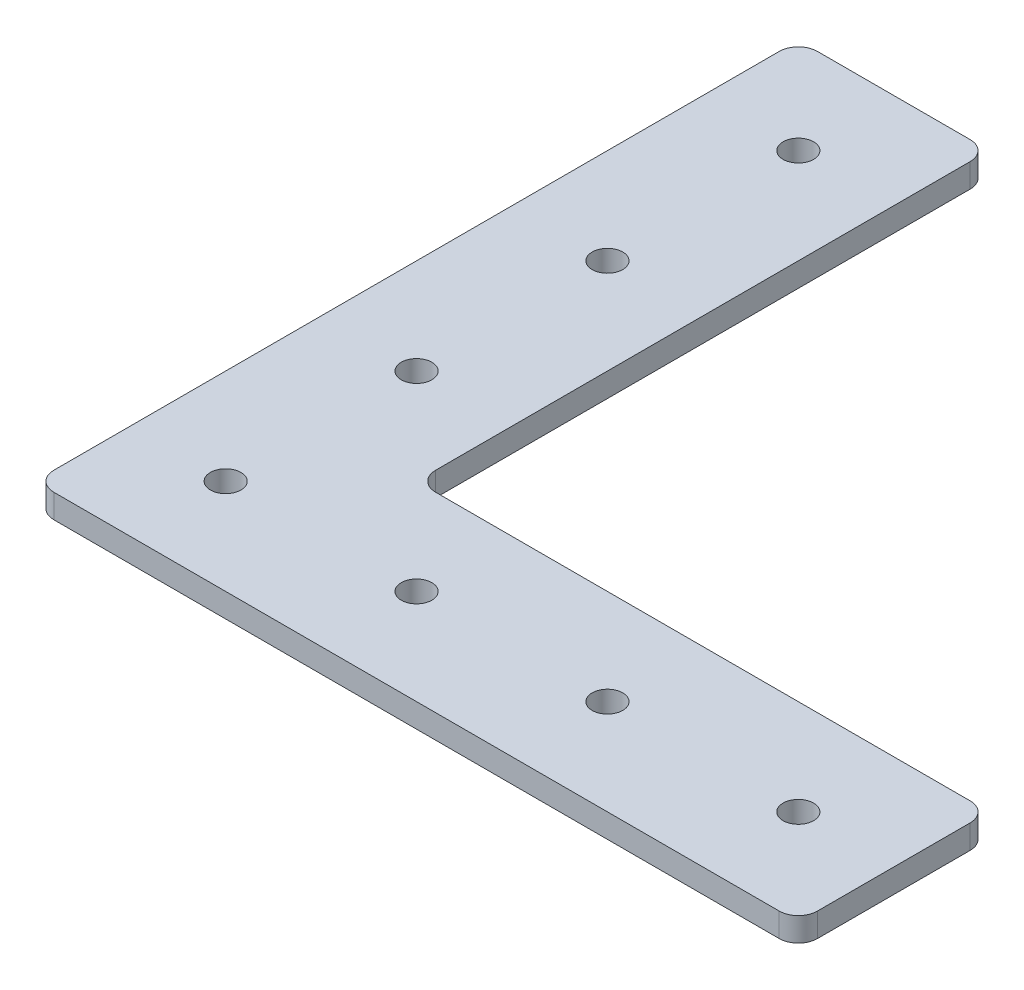
from build123d import *

# Parameters (mm, degrees)
SKETCH1_R           = 2.032
BOSS_EXTRUDE1_DEPTH = 3.175


with BuildPart() as part:
    # Sketch1 → Boss-Extrude1 (new body)
    with BuildSketch(Plane(origin=(0, 0, 0), x_dir=(1, 0, 0), z_dir=(0, 1, 0))):
        with BuildLine():
            ThreePointArc((0, 2.54), (0.743948776, 0.743948776), (2.54, 0))
            Line((2.54, 0), (25.4, 0))
            Line((25.4, 0), (99.06, 0))
            ThreePointArc((99.06, 0), (100.856051224, 0.743948776), (101.6, 2.54))
            Line((101.6, 2.54), (101.6, 22.86))
            ThreePointArc((101.6, 22.86), (100.856051224, 24.656051224), (99.06, 25.4))
            Line((99.06, 25.4), (27.94, 25.4))
            ThreePointArc((27.94, 25.4), (26.143948776, 26.143948776), (25.4, 27.94))
            Line((25.4, 27.94), (25.4, 99.06))
            ThreePointArc((25.4, 99.06), (24.656051224, 100.856051224), (22.86, 101.6))
            Line((22.86, 101.6), (2.54, 101.6))
            ThreePointArc((2.54, 101.6), (0.743948776, 100.856051224), (0, 99.06))
            Line((0, 99.06), (0, 25.4))
            Line((0, 25.4), (0, 2.54))
        make_face()
        with Locations((12.7, 12.7)):
            Circle(SKETCH1_R, mode=Mode.SUBTRACT)
        with Locations((38.1, 12.7)):
            Circle(SKETCH1_R, mode=Mode.SUBTRACT)
        with Locations((12.7, 38.1)):
            Circle(SKETCH1_R, mode=Mode.SUBTRACT)
        with Locations((63.5, 12.7)):
            Circle(SKETCH1_R, mode=Mode.SUBTRACT)
        with Locations((88.9, 12.7)):
            Circle(SKETCH1_R, mode=Mode.SUBTRACT)
        with Locations((12.7, 63.5)):
            Circle(SKETCH1_R, mode=Mode.SUBTRACT)
        with Locations((12.7, 88.9)):
            Circle(SKETCH1_R, mode=Mode.SUBTRACT)
    extrude(amount=BOSS_EXTRUDE1_DEPTH)


solid = part.part
